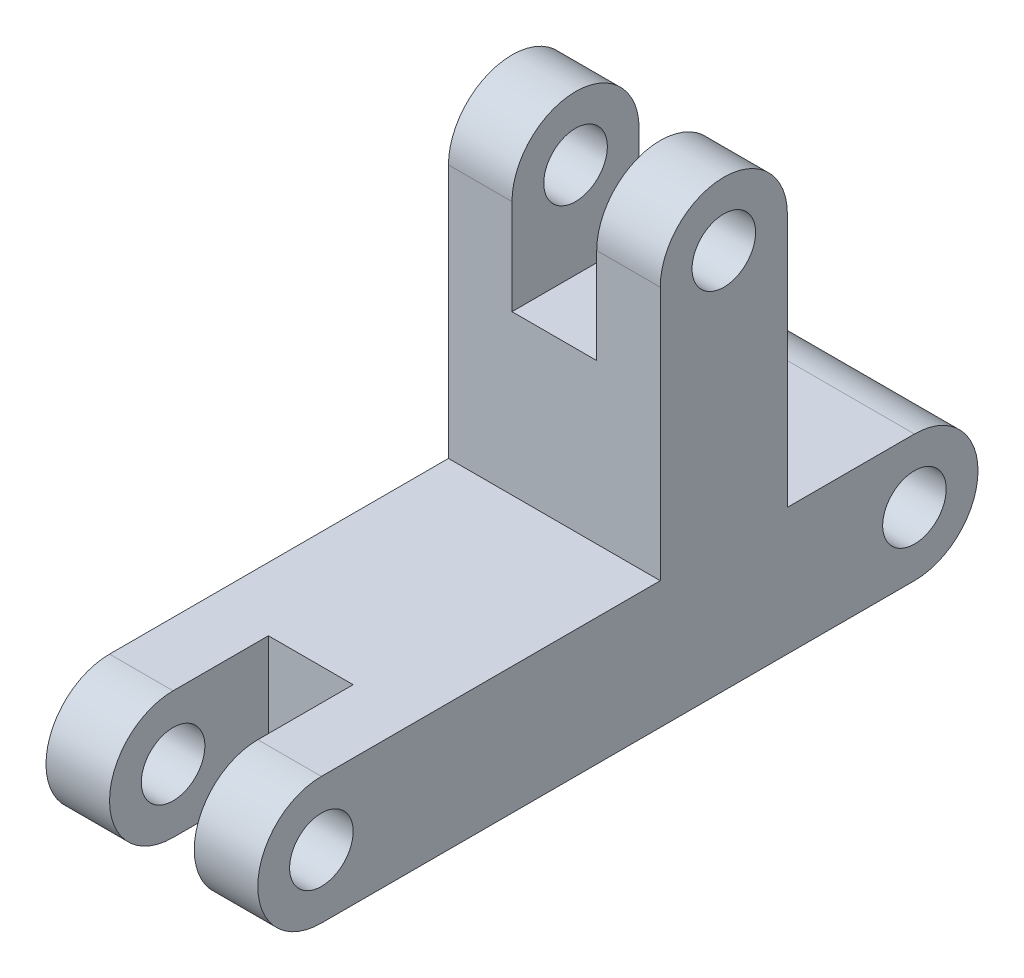
from build123d import *

# Parameters (mm, degrees)
CROQUIS1_R              = 1.5
SALIENTE_EXTRUIR1_DEPTH = 5
CROQUIS2_W              = 6
CROQUIS2_H              = 7.5
CROQUIS2_W_2            = 7.5
CROQUIS2_H_2            = 6
CORTAR_EXTRUIR1_DEPTH   = 2


with BuildPart() as part:
    # Croquis1 → Saliente-Extruir1 (new, symmetric)
    with BuildSketch(Plane(origin=(0, 0, 0), x_dir=(0, 0, -1), z_dir=(1, 0, 0))):
        with BuildLine():
            Line((-14, 3), (2, 3))
            Line((2, 3), (2, 15))
            ThreePointArc((2, 15), (5, 18), (8, 15))
            Line((8, 15), (8, 3))
            Line((8, 3), (14, 3))
            ThreePointArc((14, 3), (17, 0), (14, -3))
            Line((14, -3), (-14, -3))
            ThreePointArc((-14, -3), (-17, 0), (-14, 3))
        make_face()
        with Locations((14, 0)):
            Circle(CROQUIS1_R, mode=Mode.SUBTRACT)
        with Locations((5, 15)):
            Circle(CROQUIS1_R, mode=Mode.SUBTRACT)
        with Locations((-14, 0)):
            Circle(CROQUIS1_R, mode=Mode.SUBTRACT)
    extrude(amount=SALIENTE_EXTRUIR1_DEPTH, both=True)

    # Croquis2 → Cortar-Extruir1 (cut, symmetric)
    with BuildSketch(Plane(origin=(0, 0, 0), x_dir=(0, 0, -1), z_dir=(1, 0, 0))):
        with Locations((5, 14.25)):
            Rectangle(CROQUIS2_W, CROQUIS2_H)
        with Locations((-13.25, 0)):
            Rectangle(CROQUIS2_W_2, CROQUIS2_H_2)
    extrude(amount=CORTAR_EXTRUIR1_DEPTH, both=True, mode=Mode.SUBTRACT)


solid = part.part
